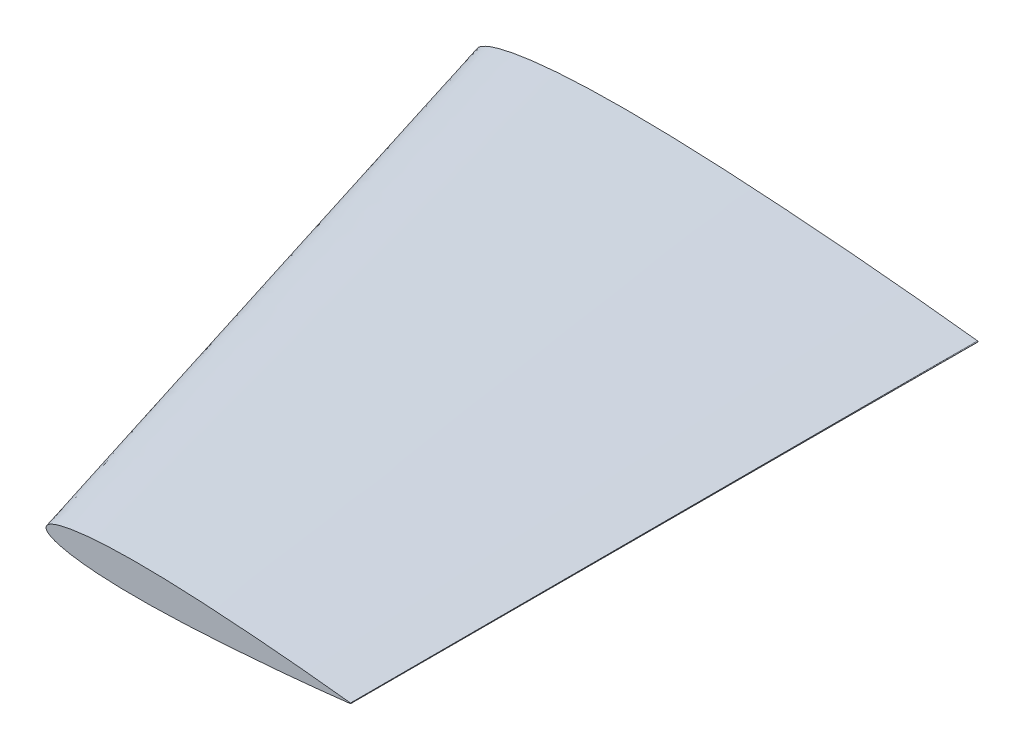
from build123d import *


with BuildPart() as part:
    # Sketch1 → По сечениям3 section 0
    with BuildSketch(Plane.XY):
        with BuildLine():
            ThreePointArc((280, 0.294), (280.294, 0), (280, -0.294))
            add(Edge.make_bspline(
                [(0, 0), (0.045422878, -0.389894137), (0.140886477, -1.209320363), (0.873309527, -2.350467837), (1.970436326, -3.423502737), (3.475023874, -4.449210521), (5.364122015, -5.434156392), (7.638959538, -6.379158414), (10.290273079, -7.282293342), (13.310396454, -8.140699644), (16.689827167, -8.951431137), (20.418850074, -9.711257404), (24.487228418, -10.417097069), (28.884406499, -11.066012327), (33.5995416, -11.655287099), (38.621491828, -12.182438584), (43.938817855, -12.645466305), (49.539812915, -13.042530024), (55.412438609, -13.372430336), (61.544368808, -13.634329844), (67.922923642, -13.82789236), (74.535077245, -13.953106272), (81.367412665, -14.010743711), (88.406125219, -14.001651506), (95.636957993, -13.927453091), (103.045188683, -13.78997787), (110.615570489, -13.591459711), (118.332326713, -13.334519871), (126.179035503, -13.0220066), (134.138630663, -12.656995547), (142.193280464, -12.242761731), (150.324372334, -11.782773695), (158.512353088, -11.280496705), (166.736668977, -10.739604811), (174.975587766, -10.16377695), (183.206071121, -9.556637959), (191.403571246, -8.922048907), (199.54179791, -8.263872404), (207.592373823, -7.58604288), (215.524530634, -6.892797304), (225.764146977, -5.965985216), (235.720654928, -5.020019601), (245.333767678, -4.063603992), (252.078636152, -3.372940289), (258.421864008, -2.705470854), (264.280195831, -2.072973255), (269.543098561, -1.491089378), (274.046585321, -0.98236597), (277.451334935, -0.591225536), (279.328071983, -0.372360302), (280, -0.294)],
                knots=[0, 0, 0, 0, 0.004099011, 0.008614742, 0.013934855, 0.020277775, 0.027752981, 0.036410215, 0.046266433, 0.057320238, 0.069558946, 0.082962861, 0.097507218, 0.113164082, 0.12990269, 0.147690304, 0.166492185, 0.186271967, 0.206991861, 0.228612215, 0.251092165, 0.274388983, 0.298458209, 0.323253842, 0.348727971, 0.374830387, 0.40150919, 0.428710016, 0.456376154, 0.484448083, 0.512863887, 0.541558094, 0.570462313, 0.599504248, 0.628607349, 0.657690446, 0.686667237, 0.715444849, 0.743923546, 0.77199483, 0.799540253, 0.852512115, 0.877624446, 0.901571134, 0.924121062, 0.944988816, 0.963803939, 0.980044339, 0.992855276, 1, 1, 1, 1], degree=3))
            add(Edge.make_bspline(
                [(280, 0.294), (279.328071983, 0.372360302), (277.451334935, 0.591225536), (274.046585321, 0.98236597), (269.543098561, 1.491089378), (264.280195831, 2.072973255), (258.421864008, 2.705470854), (252.078636152, 3.372940289), (245.333767678, 4.063603992), (235.720654928, 5.020019601), (225.764146977, 5.965985216), (215.524530634, 6.892797304), (207.592373823, 7.58604288), (199.54179791, 8.263872404), (191.403571246, 8.922048907), (183.206071121, 9.556637959), (174.975587766, 10.16377695), (166.736668977, 10.739604811), (158.512353088, 11.280496705), (150.324372334, 11.782773695), (142.193280464, 12.242761731), (134.138630663, 12.656995547), (126.179035503, 13.0220066), (118.332326713, 13.334519871), (110.615570489, 13.591459711), (103.045188683, 13.78997787), (95.636957993, 13.927453091), (88.406125219, 14.001651506), (81.367412665, 14.010743711), (74.535077245, 13.953106272), (67.922923642, 13.82789236), (61.544368808, 13.634329844), (55.412438609, 13.372430336), (49.539812915, 13.042530024), (43.938817855, 12.645466305), (38.621491828, 12.182438584), (33.5995416, 11.655287099), (28.884406499, 11.066012327), (24.487228418, 10.417097069), (20.418850074, 9.711257404), (16.689827167, 8.951431137), (13.310396454, 8.140699644), (10.290273079, 7.282293342), (7.638959538, 6.379158414), (5.364122015, 5.434156392), (3.475023874, 4.449210521), (1.970436326, 3.423502737), (0.873309527, 2.350467837), (0.140886477, 1.209320363), (0.045422878, 0.389894137), (0, 0)],
                knots=[0, 0, 0, 0, 0.007144724, 0.019955661, 0.036196061, 0.055011184, 0.075878938, 0.098428866, 0.122375554, 0.147487885, 0.200459747, 0.22800517, 0.256076454, 0.284555151, 0.313332763, 0.342309554, 0.371392651, 0.400495752, 0.429537687, 0.458441906, 0.487136113, 0.515551917, 0.543623846, 0.571289984, 0.59849081, 0.625169613, 0.651272029, 0.676746158, 0.701541791, 0.725611017, 0.748907835, 0.771387785, 0.793008139, 0.813728033, 0.833507815, 0.852309696, 0.87009731, 0.886835918, 0.902492782, 0.917037139, 0.930441054, 0.942679762, 0.953733567, 0.963589785, 0.972247019, 0.979722225, 0.986065145, 0.991385258, 0.995900989, 1, 1, 1, 1], degree=3))
        make_face()
    # Эскиз1 → По сечениям3 section 1
    with BuildSketch(Plane.XY.offset(175)):
        with BuildLine():
            Line((280, 0.23625), (280, -0.23625))
            add(Edge.make_bspline(
                [(55, 0), (55.036500527, -0.313307788), (55.113212347, -0.971775292), (55.701766584, -1.888768797), (56.583386333, -2.751028985), (57.792429899, -3.575258454), (59.310455191, -4.366732815), (61.138449629, -5.12610944), (63.268969438, -5.851842864), (65.695854293, -6.541633643), (68.411468259, -7.193114307), (71.408004524, -7.803688985), (74.677237121, -8.370881573), (78.210683794, -8.892331334), (81.999631643, -9.365855705), (86.035127361, -9.789459576), (90.307978634, -10.161535423), (94.808778235, -10.480604483), (99.527852454, -10.745702949), (104.455296364, -10.956157911), (109.580920784, -11.111699218), (114.8942585, -11.21231754), (120.384528034, -11.258633339), (126.040636336, -11.251327103), (131.851126958, -11.191703377), (137.804169477, -11.081232217), (143.887512, -10.921708697), (150.088476823, -10.715239182), (156.393867815, -10.464112446), (162.789971069, -10.170799993), (169.262457516, -9.837933534), (175.796370625, -9.468300291), (182.375998017, -9.064684852), (188.984823285, -8.63003958), (195.605383026, -8.167320764), (202.219164294, -7.679441217), (208.80644118, -7.169503586), (215.346087606, -6.640611753), (221.815300394, -6.095927315), (228.189354973, -5.538854977), (236.417618106, -4.794095263), (244.418383425, -4.033944323), (252.14320617, -3.265396065), (257.563189765, -2.710398446), (262.660426435, -2.174039079), (267.368014507, -1.66578208), (271.597132772, -1.198196822), (275.216006062, -0.789401226), (277.951965572, -0.475091948), (279.460057843, -0.2992181), (280, -0.23625)],
                knots=[0, 0, 0, 0, 0.004099011, 0.008614742, 0.013934855, 0.020277775, 0.027752981, 0.036410215, 0.046266433, 0.057320238, 0.069558946, 0.082962861, 0.097507218, 0.113164082, 0.12990269, 0.147690304, 0.166492185, 0.186271967, 0.206991861, 0.228612215, 0.251092165, 0.274388983, 0.298458209, 0.323253842, 0.348727971, 0.374830387, 0.40150919, 0.428710016, 0.456376154, 0.484448083, 0.512863887, 0.541558094, 0.570462313, 0.599504248, 0.628607349, 0.657690446, 0.686667237, 0.715444849, 0.743923546, 0.77199483, 0.799540253, 0.852512115, 0.877624446, 0.901571134, 0.924121062, 0.944988816, 0.963803939, 0.980044339, 0.992855276, 1, 1, 1, 1], degree=3))
            add(Edge.make_bspline(
                [(280, 0.23625), (279.460057843, 0.2992181), (277.951965572, 0.475091948), (275.216006062, 0.789401226), (271.597132772, 1.198196822), (267.368014507, 1.66578208), (262.660426435, 2.174039079), (257.563189765, 2.710398446), (252.14320617, 3.265396065), (244.418383425, 4.033944323), (236.417618106, 4.794095263), (228.189354973, 5.538854977), (221.815300394, 6.095927315), (215.346087606, 6.640611753), (208.80644118, 7.169503586), (202.219164294, 7.679441217), (195.605383026, 8.167320764), (188.984823285, 8.63003958), (182.375998017, 9.064684852), (175.796370625, 9.468300291), (169.262457516, 9.837933534), (162.789971069, 10.170799993), (156.393867815, 10.464112446), (150.088476823, 10.715239182), (143.887512, 10.921708697), (137.804169477, 11.081232217), (131.851126958, 11.191703377), (126.040636336, 11.251327103), (120.384528034, 11.258633339), (114.8942585, 11.21231754), (109.580920784, 11.111699218), (104.455296364, 10.956157911), (99.527852454, 10.745702949), (94.808778235, 10.480604483), (90.307978634, 10.161535423), (86.035127361, 9.789459576), (81.999631643, 9.365855705), (78.210683794, 8.892331334), (74.677237121, 8.370881573), (71.408004524, 7.803688985), (68.411468259, 7.193114307), (65.695854293, 6.541633643), (63.268969438, 5.851842864), (61.138449629, 5.12610944), (59.310455191, 4.366732815), (57.792429899, 3.575258454), (56.583386333, 2.751028985), (55.701766584, 1.888768797), (55.113212347, 0.971775292), (55.036500527, 0.313307788), (55, 0)],
                knots=[0, 0, 0, 0, 0.007144724, 0.019955661, 0.036196061, 0.055011184, 0.075878938, 0.098428866, 0.122375554, 0.147487885, 0.200459747, 0.22800517, 0.256076454, 0.284555151, 0.313332763, 0.342309554, 0.371392651, 0.400495752, 0.429537687, 0.458441906, 0.487136113, 0.515551917, 0.543623846, 0.571289984, 0.59849081, 0.625169613, 0.651272029, 0.676746158, 0.701541791, 0.725611017, 0.748907835, 0.771387785, 0.793008139, 0.813728033, 0.833507815, 0.852309696, 0.87009731, 0.886835918, 0.902492782, 0.917037139, 0.930441054, 0.942679762, 0.953733567, 0.963589785, 0.972247019, 0.979722225, 0.986065145, 0.991385258, 0.995900989, 1, 1, 1, 1], degree=3))
        make_face()
    # Эскиз2 → По сечениям3 section 2
    with BuildSketch(Plane.XY.offset(350)):
        with BuildLine():
            Line((280, 0.1785), (280, -0.1785))
            add(Edge.make_bspline(
                [(110, 0), (110.027578176, -0.23672144), (110.085538218, -0.73423022), (110.530223642, -1.427069758), (111.196336341, -2.078555233), (112.109835923, -2.701306388), (113.256788366, -3.299309238), (114.63793972, -3.873060466), (116.247665798, -4.421392386), (118.081312133, -4.942567641), (120.133109351, -5.434797476), (122.397158974, -5.896120566), (124.867245825, -6.324666077), (127.536961089, -6.718650341), (130.399721686, -7.07642431), (133.448762895, -7.396480569), (136.677139412, -7.677604542), (140.077743555, -7.918678943), (143.643266298, -8.118975561), (147.366223919, -8.277985977), (151.238917925, -8.395506076), (155.253439756, -8.471528808), (159.401643404, -8.506522967), (163.675147454, -8.5010027), (168.065295924, -8.455953662), (172.563150272, -8.372486564), (177.159453511, -8.251957682), (181.844626933, -8.095958493), (186.608700127, -7.906218293), (191.441311474, -7.684604439), (196.331634567, -7.433105337), (201.268368917, -7.153826886), (206.239642946, -6.848873), (211.232977593, -6.52047435), (216.235178286, -6.170864577), (221.232257467, -5.802244475), (226.209311114, -5.416958265), (231.150377303, -5.017351103), (236.038226964, -4.605811749), (240.854179313, -4.184912649), (247.071089236, -3.62220531), (253.116111921, -3.047869044), (258.952644662, -2.467188138), (263.047743378, -2.047856604), (266.898988862, -1.642607304), (270.455833183, -1.258590905), (273.651166984, -0.905304265), (276.385426802, -0.596436482), (278.45259621, -0.358958361), (279.592043704, -0.226075898), (280, -0.1785)],
                knots=[0, 0, 0, 0, 0.004099011, 0.008614742, 0.013934855, 0.020277775, 0.027752981, 0.036410215, 0.046266433, 0.057320238, 0.069558946, 0.082962861, 0.097507218, 0.113164082, 0.12990269, 0.147690304, 0.166492185, 0.186271967, 0.206991861, 0.228612215, 0.251092165, 0.274388983, 0.298458209, 0.323253842, 0.348727971, 0.374830387, 0.40150919, 0.428710016, 0.456376154, 0.484448083, 0.512863887, 0.541558094, 0.570462313, 0.599504248, 0.628607349, 0.657690446, 0.686667237, 0.715444849, 0.743923546, 0.77199483, 0.799540253, 0.852512115, 0.877624446, 0.901571134, 0.924121062, 0.944988816, 0.963803939, 0.980044339, 0.992855276, 1, 1, 1, 1], degree=3))
            add(Edge.make_bspline(
                [(280, 0.1785), (279.592043704, 0.226075898), (278.45259621, 0.358958361), (276.385426802, 0.596436482), (273.651166984, 0.905304265), (270.455833183, 1.258590905), (266.898988862, 1.642607304), (263.047743378, 2.047856604), (258.952644662, 2.467188138), (253.116111921, 3.047869044), (247.071089236, 3.62220531), (240.854179313, 4.184912649), (236.038226964, 4.605811749), (231.150377303, 5.017351103), (226.209311114, 5.416958265), (221.232257467, 5.802244475), (216.235178286, 6.170864577), (211.232977593, 6.52047435), (206.239642946, 6.848873), (201.268368917, 7.153826886), (196.331634567, 7.433105337), (191.441311474, 7.684604439), (186.608700127, 7.906218293), (181.844626933, 8.095958493), (177.159453511, 8.251957682), (172.563150272, 8.372486564), (168.065295924, 8.455953662), (163.675147454, 8.5010027), (159.401643404, 8.506522967), (155.253439756, 8.471528808), (151.238917925, 8.395506076), (147.366223919, 8.277985977), (143.643266298, 8.118975561), (140.077743555, 7.918678943), (136.677139412, 7.677604542), (133.448762895, 7.396480569), (130.399721686, 7.07642431), (127.536961089, 6.718650341), (124.867245825, 6.324666077), (122.397158974, 5.896120566), (120.133109351, 5.434797476), (118.081312133, 4.942567641), (116.247665798, 4.421392386), (114.63793972, 3.873060466), (113.256788366, 3.299309238), (112.109835923, 2.701306388), (111.196336341, 2.078555233), (110.530223642, 1.427069758), (110.085538218, 0.73423022), (110.027578176, 0.23672144), (110, 0)],
                knots=[0, 0, 0, 0, 0.007144724, 0.019955661, 0.036196061, 0.055011184, 0.075878938, 0.098428866, 0.122375554, 0.147487885, 0.200459747, 0.22800517, 0.256076454, 0.284555151, 0.313332763, 0.342309554, 0.371392651, 0.400495752, 0.429537687, 0.458441906, 0.487136113, 0.515551917, 0.543623846, 0.571289984, 0.59849081, 0.625169613, 0.651272029, 0.676746158, 0.701541791, 0.725611017, 0.748907835, 0.771387785, 0.793008139, 0.813728033, 0.833507815, 0.852309696, 0.87009731, 0.886835918, 0.902492782, 0.917037139, 0.930441054, 0.942679762, 0.953733567, 0.963589785, 0.972247019, 0.979722225, 0.986065145, 0.991385258, 0.995900989, 1, 1, 1, 1], degree=3))
        make_face()
    loft()


solid = part.part
